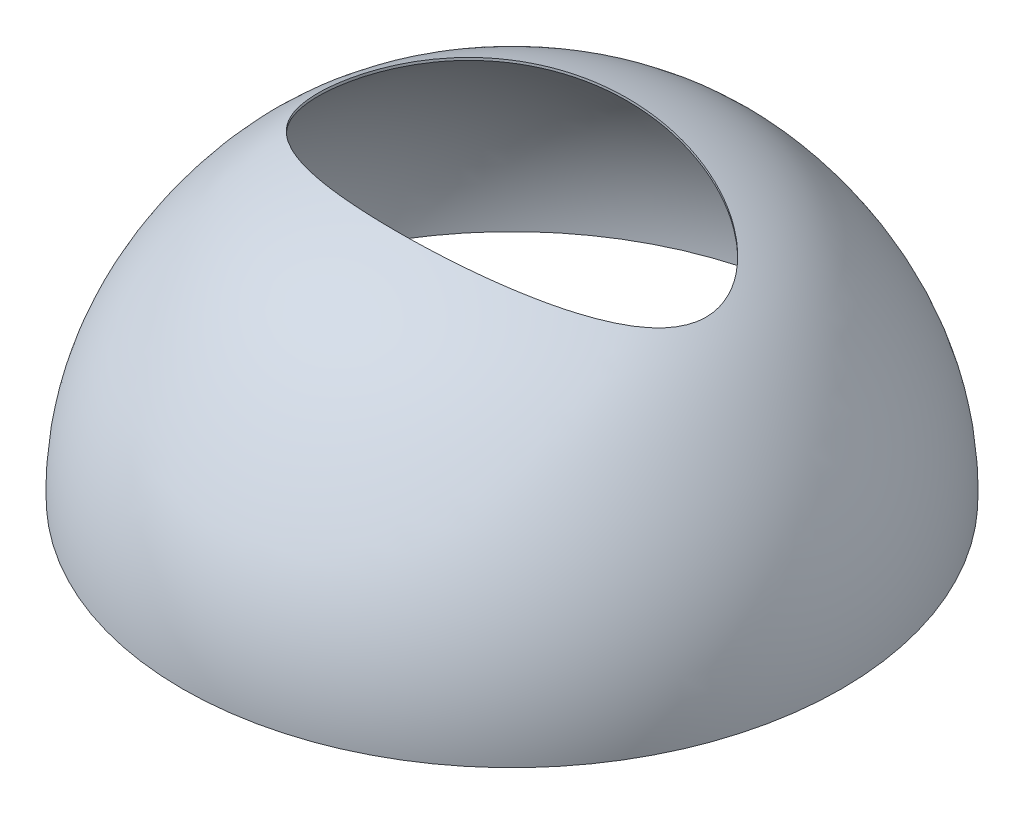
from build123d import *

# Parameters (mm, degrees)
ROTATION_D_NN1_OUTLINE_W        = 0.113188128
ROTATION_D_NN1_OUTLINE_H        = 1
ROTATION_D_NN1_OUTLINE_W_2      = 29.886811872
SKIZZE2_RX                      = 82.455867631
SKIZZE2_RY                      = 49.027813186
SCHNITT_LINEAR_AUSTRAGEN1_DEPTH = 202


# Read off the part's stored shape, not the designer's step: Rotation-Dünn1
with BuildPart() as part:
    # Rotation-Dünn1 outline → Rotation-Dünn1 (revolve)
    with BuildSketch(Plane.XY):
        with BuildLine():
            Line((30, 127), (29.886811872, 127))
            add(Edge.make_bspline(
                [(29.886811872, 127), (29.924538025, 126.991342103), (29.962267412, 126.982676498), (30, 126.97400316)],
                knots=[0, 0, 0, 0, 0.000648386, 0.000648386, 0.000648386, 0.000648386], degree=3))
            Line((30, 126.97400316), (30, 127))
        make_face()
        with Locations((29.943405936, 127.5)):
            Rectangle(ROTATION_D_NN1_OUTLINE_W, ROTATION_D_NN1_OUTLINE_H)
        with Locations((14.943405936, 127.5)):
            Rectangle(ROTATION_D_NN1_OUTLINE_W_2, ROTATION_D_NN1_OUTLINE_H)
        with BuildLine():
            Line((30, 127), (30, 126.97400316))
            add(Edge.make_bspline(
                [(30, 126.97400316), (44.510930435, 123.638472658), (59.495176103, 119.159470388), (76.380216283, 110.552780869), (79.671165399, 108.677112642), (84.422549965, 105.608187262), (85.975511888, 104.542641875), (89.012296056, 102.321504936), (90.49517076, 101.165037475), (97.739385685, 95.156031588), (102.99272173, 89.639702729), (109.009496988, 82.247417665), (110.185400974, 80.744102894), (112.48523463, 77.697900025), (113.608562564, 76.155497402), (116.893290722, 71.472522119), (118.969431326, 68.276183218), (124.813040843, 58.481166274), (128.195628137, 51.67655385), (135.731724357, 32.424575519), (138.61688744, 19.516320947), (139.000412177, 6.138810058)],
                knots=[0.000648386, 0.000648386, 0.000648386, 0.000648386, 0.25, 0.25, 0.3125, 0.3125, 0.34375, 0.34375, 0.375, 0.375, 0.5, 0.5, 0.53125, 0.53125, 0.5625, 0.5625, 0.625, 0.625, 0.75, 0.75, 0.967115187, 0.967115187, 0.967115187, 0.967115187], degree=3))
            Line((139.000412177, 6.138810058), (139.000412177, 18.082835303))
            add(Edge.make_bspline(
                [(34.231854255, 127), (53.794868782, 122.23046394), (84.406099271, 111.53658079), (121.145862461, 71.531144113), (135.852614284, 40.724022307), (139.000412177, 18.082835303)],
                knots=[0.024087618, 0.024087618, 0.024087618, 0.024087618, 0.357284479, 0.530346239, 0.902596657, 0.902596657, 0.902596657, 0.902596657], degree=3))
            Line((34.231854255, 127), (30, 127))
        make_face()
        with BuildLine():
            Line((30, 128), (30, 127))
            Line((30, 127), (34.231854255, 127))
            add(Edge.make_bspline(
                [(30, 128), (31.406389392, 127.677746239), (32.817595948, 127.344801461), (34.231854255, 127)],
                knots=[0, 0, 0, 0, 0.024087618, 0.024087618, 0.024087618, 0.024087618], degree=3))
        make_face()
        with BuildLine():
            Line((139.000412177, 18.082835303), (139.000412177, 6.138810058))
            add(Edge.make_bspline(
                [(139.000412177, 6.138810058), (139.0585018, 4.112618545), (139.059201601, 2.075661872), (139.000412177, 0.028708614)],
                knots=[0.967115187, 0.967115187, 0.967115187, 0.967115187, 1, 1, 1, 1], degree=3))
            Line((139.000412177, 0.028708614), (140, 0.028708614))
            Line((140, 0.028708614), (140, 6.165779952))
            add(Edge.make_bspline(
                [(139.000412177, 18.082835303), (139.546235838, 14.156885796), (139.884849944, 10.18249532), (140, 6.165779952)],
                knots=[0.902596657, 0.902596657, 0.902596657, 0.902596657, 0.967144348, 0.967144348, 0.967144348, 0.967144348], degree=3))
        make_face()
        Polygon((140, 0.028708614), (139.000412177, 0.028708614), (140, 0), align=None)
        with BuildLine():
            Line((140, 0.028708614), (140, 0))
            add(Edge.make_bspline(
                [(140.000820677, 0.028708614), (140.000548407, 0.019139294), (140.000274848, 0.009569756), (140, 0)],
                knots=[0.999847789, 0.999847789, 0.999847789, 0.999847789, 1, 1, 1, 1], degree=3))
            Line((140.000820677, 0.028708614), (140, 0.028708614))
        make_face()
        with BuildLine():
            Line((140, 6.165779952), (140, 0.028708614))
            Line((140, 0.028708614), (140.000820677, 0.028708614))
            add(Edge.make_bspline(
                [(140.044228074, 3.081473717), (140.044228082, 2.066428849), (140.029845016, 1.048808097), (140.000820677, 0.028708614)],
                knots=[0.983621934, 0.983621934, 0.983621934, 0.983621934, 0.999847789, 0.999847789, 0.999847789, 0.999847789], degree=3))
            add(Edge.make_bspline(
                [(140, 6.165779952), (140.02939524, 5.140402132), (140.044228066, 4.112266139), (140.044228074, 3.081473717)],
                knots=[0.967144348, 0.967144348, 0.967144348, 0.967144348, 0.983621934, 0.983621934, 0.983621934, 0.983621934], degree=3))
        make_face()
    revolve(axis=Axis((0, 0, 0), (0, 1, 0)))

    # Skizze2 → Schnitt-Linear austragen1 (cut)
    with BuildSketch(Plane(origin=(0, 0, 0), x_dir=(1, 0, 0), z_dir=(0, 1, 0))):
        with Locations(Location((0, 0), (0, 0, 180))):
            Ellipse(SKIZZE2_RX, SKIZZE2_RY)
    extrude(amount=SCHNITT_LINEAR_AUSTRAGEN1_DEPTH, mode=Mode.SUBTRACT)


solid = part.part
